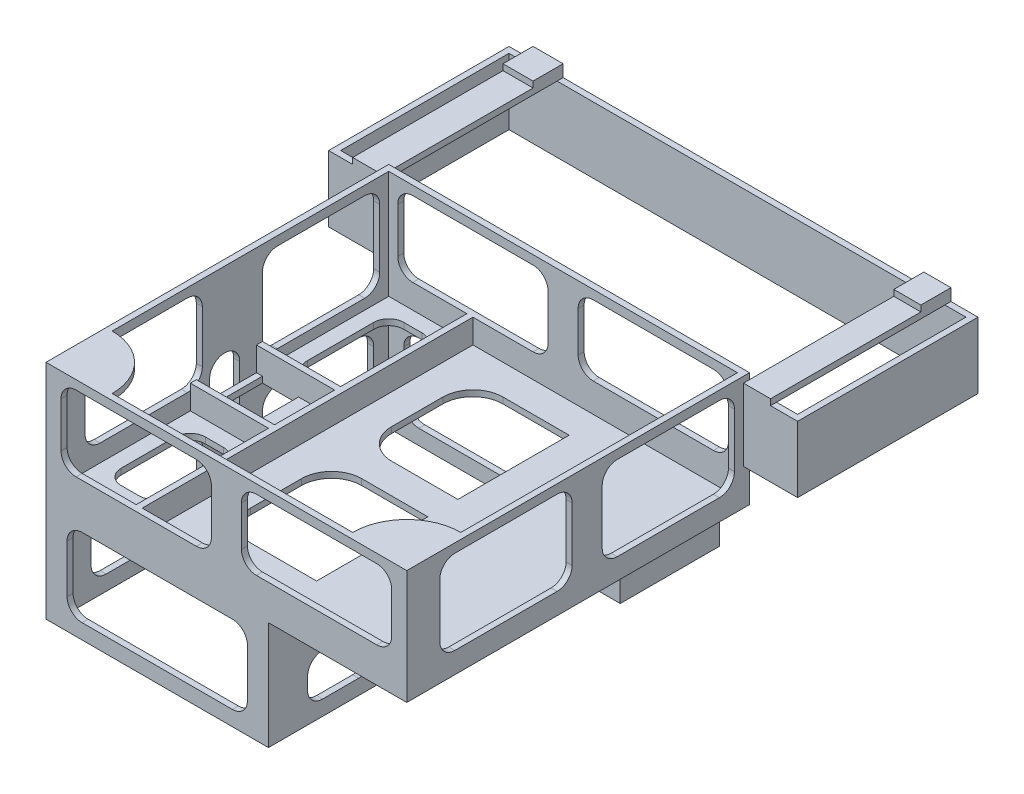
from build123d import *

# Parameters (mm, degrees)
SKETCH1_W                = 60
SKETCH1_H                = 54
BOSS_EXTRUDE1_DEPTH      = 38
SKETCH2_W                = 44
SKETCH2_H                = 52
CUT_EXTRUDE1_DEPTH       = 19
SKETCH3_W                = 35
SKETCH3_H                = 52
CUT_EXTRUDE2_DEPTH       = 18
SKETCH4_W                = 6
SKETCH4_H                = 10
CUT_EXTRUDE3_DEPTH       = 38
SKETCH5_W                = 14
SKETCH5_H                = 52
CUT_EXTRUDE5_DEPTH       = 15
SKETCH6_W                = 13
SKETCH6_H                = 52
CUT_EXTRUDE6_DEPTH       = 4
SKETCH8_W                = 14
SKETCH8_H                = 12.5
CUT_EXTRUDE7_DEPTH       = 6
SKETCH10_W               = 12.5
SKETCH10_H               = 5
CUT_EXTRUDE8_DEPTH       = 6
SKETCH11_W               = 4.5
SKETCH11_H               = 5
CUT_EXTRUDE9_DEPTH       = 18
SKETCH12_W               = 5
SKETCH12_H               = 17
CUT_EXTRUDE10_DEPTH      = 13
CUT_EXTRUDE11_DEPTH      = 1
SKETCH14_W               = 13
SKETCH14_H               = 1
BOSS_EXTRUDE2_DEPTH      = 4
SKETCH15_W               = 13
SKETCH15_H               = 1
BOSS_EXTRUDE3_DEPTH      = 4
CUT_EXTRUDE12_DEPTH      = 1
CUT_EXTRUDE13_DEPTH      = 1
CUT_EXTRUDE14_DEPTH      = 1
CUT_EXTRUDE15_DEPTH      = 60
CUT_EXTRUDE16_START      = -1
CUT_EXTRUDE16_DEPTH      = 1
CUT_EXTRUDE17_DEPTH      = 89
CUT_EXTRUDE17_DEPTH_BACK = 10
CUT_EXTRUDE18_DEPTH      = 10
SKETCH23_W               = 58
SKETCH23_H               = 52
BOSS_EXTRUDE4_DEPTH      = 1
SKETCH24_W               = 40
SKETCH24_H               = 10
SKETCH24_W_2             = 10
SKETCH24_H_2             = 34
CUT_EXTRUDE20_DEPTH      = 1
FILLET1_R                = 9
FILLET2_R                = 9
FILLET3_R                = 9
FILLET4_R                = 9
SKETCH27_W               = 10
SKETCH27_H               = 11
BOSS_EXTRUDE10_DEPTH     = 1
SKETCH31_W               = 1
SKETCH31_H               = 11
BOSS_EXTRUDE12_DEPTH     = 29
SKETCH33_W               = 1
SKETCH33_H               = 11
BOSS_EXTRUDE13_DEPTH     = 78
SKETCH34_W               = 5
SKETCH34_H               = 30
SKETCH34_W_2             = 4.5
BOSS_EXTRUDE14_DEPTH     = 1
SKETCH35_W               = 28
SKETCH35_H               = 11
BOSS_EXTRUDE15_DEPTH     = 1
SKETCH37_W               = 30
SKETCH37_H               = 11
CUT_EXTRUDE21_DEPTH      = 1
SKETCH38_W               = 28
SKETCH38_H               = 11
BOSS_EXTRUDE16_DEPTH     = 1
SKETCH39_W               = 30
SKETCH39_H               = 11
CUT_EXTRUDE22_DEPTH      = 1
SKETCH40_W               = 60
SKETCH40_H               = 37
BOSS_EXTRUDE17_DEPTH     = 3
SKETCH41_W               = 35
SKETCH41_H               = 18
CUT_EXTRUDE23_DEPTH      = 3
SKETCH42_W               = 44
SKETCH42_H               = 18
CUT_EXTRUDE24_DEPTH      = 3
SKETCH44_W               = 13
SKETCH44_H               = 18
CUT_EXTRUDE25_DEPTH      = 3
SKETCH45_W               = 3
SKETCH45_H               = 14
CUT_EXTRUDE26_DEPTH      = 3
SKETCH47_W               = 60
SKETCH47_H               = 10
CUT_EXTRUDE27_DEPTH      = 1
SKETCH48_W               = 60
SKETCH48_H               = 10
CUT_EXTRUDE28_DEPTH      = 1
SKETCH49_W               = 60
SKETCH49_H               = 10
BOSS_EXTRUDE18_DEPTH     = 1
SKETCH50_W               = 40
SKETCH50_H               = 9
CUT_EXTRUDE29_DEPTH      = 1
FILLET5_R                = 9
FILLET6_R                = 9
SKETCH51_W               = 5
SKETCH51_H               = 5
SKETCH51_W_2             = 4.5
BOSS_EXTRUDE19_DEPTH     = 1
SKETCH53_W               = 8
SKETCH53_H               = 9
CUT_EXTRUDE30_DEPTH      = 18
SKETCH54_W               = 2.5
SKETCH54_H               = 16.5
CUT_EXTRUDE31_DEPTH      = 18
SKETCH55_W               = 19.362337095
SKETCH55_H               = 47.149460103
BOSS_EXTRUDE20_DEPTH     = 1
SKETCH57_W               = 15
SKETCH57_H               = 9
CUT_EXTRUDE32_DEPTH      = 15
SKETCH58_W               = 6.289823119
SKETCH58_H               = 14.401479923
BOSS_EXTRUDE21_DEPTH     = 1
SKETCH59_W               = 15
SKETCH59_H               = 9
BOSS_EXTRUDE26_DEPTH     = 1
SKETCH60_W               = 4.5
SKETCH60_H               = 5
CUT_EXTRUDE33_DEPTH      = 1
SKETCH61_W               = 14
SKETCH61_H               = 12.5
CUT_EXTRUDE34_DEPTH      = 18
SKETCH62_W               = 12.5
SKETCH62_H               = 5
CUT_EXTRUDE35_DEPTH      = 18
SKETCH63_W               = 20.5
SKETCH63_H               = 16.5
CUT_EXTRUDE36_DEPTH      = 12
SKETCH64_W               = 13.575669256
SKETCH64_H               = 6.720460735
BOSS_EXTRUDE27_DEPTH     = 1
CUT_EXTRUDE37_START      = -1
CUT_EXTRUDE37_DEPTH      = 1
CUT_EXTRUDE38_DEPTH      = 1
CUT_EXTRUDE39_DEPTH      = 1


with BuildPart() as part:
    # Sketch1 → Boss-Extrude1 (new body)
    with BuildSketch(Plane(origin=(0, 0, 0), x_dir=(1, 0, 0), z_dir=(0, 1, 0))):
        with Locations((-83.874465942, -33.946435202)):
            Rectangle(SKETCH1_W, SKETCH1_H)
    extrude(amount=BOSS_EXTRUDE1_DEPTH)

    # Sketch2 → Cut-Extrude1 (cut)
    with BuildSketch(Plane(origin=(0, 38, 0), x_dir=(1, 0, 0), z_dir=(0, 1, 0))):
        with Locations((-76.874465942, -33.946435202)):
            Rectangle(SKETCH2_W, SKETCH2_H)
    extrude(amount=-CUT_EXTRUDE1_DEPTH, mode=Mode.SUBTRACT)

    # Sketch3 → Cut-Extrude2 (cut)
    with BuildSketch(Plane(origin=(0, 0, 0), x_dir=(-1, 0, 0), z_dir=(0, -1, 0))):
        with Locations((95.374465942, -33.946435202)):
            Rectangle(SKETCH3_W, SKETCH3_H)
    extrude(amount=-CUT_EXTRUDE2_DEPTH, mode=Mode.SUBTRACT)

    # Sketch4 → Cut-Extrude3 (cut)
    with BuildSketch(Plane(origin=(0, 18, 0), x_dir=(-1, 0, 0), z_dir=(0, -1, 0))):
        with Locations((108.874465942, -34.946435202)):
            Rectangle(SKETCH4_W, SKETCH4_H)
    extrude(amount=-CUT_EXTRUDE3_DEPTH, mode=Mode.SUBTRACT)

    # Sketch5 → Cut-Extrude5 (cut)
    with BuildSketch(Plane(origin=(0, 38, 0), x_dir=(1, 0, 0), z_dir=(0, 1, 0))):
        with Locations((-105.874465942, -33.946435202)):
            Rectangle(SKETCH5_W, SKETCH5_H)
    extrude(amount=-CUT_EXTRUDE5_DEPTH, mode=Mode.SUBTRACT)

    # Sketch6 → Cut-Extrude6 (cut)
    with BuildSketch(Plane(origin=(0, 23, 0), x_dir=(1, 0, 0), z_dir=(0, 1, 0))):
        with Locations((-106.374465942, -33.946435202)):
            Rectangle(SKETCH6_W, SKETCH6_H)
    extrude(amount=-CUT_EXTRUDE6_DEPTH, mode=Mode.SUBTRACT)

    # Sketch8 → Cut-Extrude7 (cut)
    with BuildSketch(Plane(origin=(0, 0, 0), x_dir=(-1, 0, 0), z_dir=(0, -1, 0))):
        with Locations((65.374465942, -17.696435202)):
            Rectangle(SKETCH8_W, SKETCH8_H)
    extrude(amount=-CUT_EXTRUDE7_DEPTH, mode=Mode.SUBTRACT)

    # Sketch10 → Cut-Extrude8 (cut)
    with BuildSketch(Plane(origin=(-72.374465942, 0, 0), x_dir=(0, 0, -1), z_dir=(1, 0, 0))):
        with Locations((-17.696435202, 3.5)):
            Rectangle(SKETCH10_W, SKETCH10_H)
    extrude(amount=-CUT_EXTRUDE8_DEPTH, mode=Mode.SUBTRACT)

    # Sketch11 → Cut-Extrude9 (cut)
    with BuildSketch(Plane.XZ):
        with Locations((-66.124465942, 48.446435202)):
            Rectangle(SKETCH11_W, SKETCH11_H)
    extrude(amount=-CUT_EXTRUDE9_DEPTH, mode=Mode.SUBTRACT)

    # Sketch12 → Cut-Extrude10 (cut)
    with BuildSketch(Plane(origin=(-68.374465942, 0, 0), x_dir=(0, 0, -1), z_dir=(1, 0, 0))):
        with Locations((-48.446435202, 9.5)):
            Rectangle(SKETCH12_W, SKETCH12_H)
    extrude(amount=-CUT_EXTRUDE10_DEPTH, mode=Mode.SUBTRACT)

    # Sketch13 → Cut-Extrude11 (cut)
    with BuildSketch(Plane.ZY.offset(113.874465942)):
        with BuildLine():
            Line((32.733045904, 15), (32.733045904, 22))
            ThreePointArc((32.733045904, 22), (35.233045904, 24.5), (37.733045904, 22))
            Line((37.733045904, 22), (37.733045904, 15))
            ThreePointArc((37.733045904, 15), (35.233045904, 12.5), (32.733045904, 15))
        make_face()
    extrude(amount=-CUT_EXTRUDE11_DEPTH, mode=Mode.SUBTRACT)

    # Sketch14 → Boss-Extrude2 (add)
    with BuildSketch(Plane(origin=(0, 19, 0), x_dir=(1, 0, 0), z_dir=(0, 1, 0))):
        with Locations((-106.374465942, -40.446435202)):
            Rectangle(SKETCH14_W, SKETCH14_H)
    extrude(amount=BOSS_EXTRUDE2_DEPTH)

    # Sketch15 → Boss-Extrude3 (add)
    with BuildSketch(Plane(origin=(0, 19, 0), x_dir=(1, 0, 0), z_dir=(0, 1, 0))):
        with Locations((-106.374465942, -29.446435202)):
            Rectangle(SKETCH15_W, SKETCH15_H)
    extrude(amount=BOSS_EXTRUDE3_DEPTH)

    # Sketch16 → Cut-Extrude12 (cut)
    with BuildSketch(Plane(origin=(0, 19, 0), x_dir=(1, 0, 0), z_dir=(0, 1, 0))):
        with BuildLine():
            Line((-64.874465942, -54.946435202), (-88.874465942, -54.946435202))
            ThreePointArc((-88.874465942, -54.946435202), (-92.409999848, -53.481969108), (-93.874465942, -49.946435202))
            Line((-93.874465942, -49.946435202), (-93.874465942, -41.446435202))
            ThreePointArc((-93.874465942, -41.446435202), (-92.409999848, -37.910901296), (-88.874465942, -36.446435202))
            Line((-88.874465942, -36.446435202), (-64.874465942, -36.446435202))
            ThreePointArc((-64.874465942, -36.446435202), (-61.338932037, -37.910901296), (-59.874465942, -41.446435202))
            Line((-59.874465942, -41.446435202), (-59.874465942, -49.946435202))
            ThreePointArc((-59.874465942, -49.946435202), (-61.338932037, -53.481969108), (-64.874465942, -54.946435202))
        make_face()
        with BuildLine():
            Line((-88.874465942, -31.446435202), (-64.874465942, -31.446435202))
            ThreePointArc((-64.874465942, -31.446435202), (-61.338932037, -29.981969108), (-59.874465942, -26.446435202))
            Line((-59.874465942, -26.446435202), (-59.874465942, -17.946435202))
            ThreePointArc((-59.874465942, -17.946435202), (-61.338932037, -14.410901296), (-64.874465942, -12.946435202))
            Line((-64.874465942, -12.946435202), (-88.874465942, -12.946435202))
            ThreePointArc((-88.874465942, -12.946435202), (-92.409999848, -14.410901296), (-93.874465942, -17.946435202))
            Line((-93.874465942, -17.946435202), (-93.874465942, -26.446435202))
            ThreePointArc((-93.874465942, -26.446435202), (-92.409999848, -29.981969108), (-88.874465942, -31.446435202))
        make_face()
    extrude(amount=-CUT_EXTRUDE12_DEPTH, mode=Mode.SUBTRACT)

    # Sketch17 → Cut-Extrude13 (cut)
    with BuildSketch(Plane(origin=(0, 19, 0), x_dir=(1, 0, 0), z_dir=(0, 1, 0))):
        with BuildLine():
            Line((-104.874465942, -57.446435202), (-107.874465942, -57.446435202))
            ThreePointArc((-107.874465942, -57.446435202), (-109.642232895, -56.714202155), (-110.374465942, -54.946435202))
            Line((-110.374465942, -54.946435202), (-110.374465942, -45.946435202))
            ThreePointArc((-110.374465942, -45.946435202), (-109.642232895, -44.178668249), (-107.874465942, -43.446435202))
            Line((-107.874465942, -43.446435202), (-104.874465942, -43.446435202))
            ThreePointArc((-104.874465942, -43.446435202), (-103.10669899, -44.178668249), (-102.374465942, -45.946435202))
            Line((-102.374465942, -45.946435202), (-102.374465942, -54.946435202))
            ThreePointArc((-102.374465942, -54.946435202), (-103.10669899, -56.714202155), (-104.874465942, -57.446435202))
        make_face()
        with BuildLine():
            Line((-104.874465942, -26.446435202), (-107.874465942, -26.446435202))
            ThreePointArc((-107.874465942, -26.446435202), (-109.642232895, -25.714202155), (-110.374465942, -23.946435202))
            Line((-110.374465942, -23.946435202), (-110.374465942, -12.946435202))
            ThreePointArc((-110.374465942, -12.946435202), (-109.642232895, -11.178668249), (-107.874465942, -10.446435202))
            Line((-107.874465942, -10.446435202), (-104.874465942, -10.446435202))
            ThreePointArc((-104.874465942, -10.446435202), (-103.10669899, -11.178668249), (-102.374465942, -12.946435202))
            Line((-102.374465942, -12.946435202), (-102.374465942, -23.946435202))
            ThreePointArc((-102.374465942, -23.946435202), (-103.10669899, -25.714202155), (-104.874465942, -26.446435202))
        make_face()
    extrude(amount=-CUT_EXTRUDE13_DEPTH, mode=Mode.SUBTRACT)

    # Sketch18 → Cut-Extrude14 (cut)
    with BuildSketch(Plane(origin=(-53.874465942, 0, 0), x_dir=(0, 0, -1), z_dir=(1, 0, 0))):
        with BuildLine():
            Line((-55.946435202, 35.5), (-38.946435202, 35.5))
            ThreePointArc((-38.946435202, 35.5), (-37.178668249, 34.767766953), (-36.446435202, 33))
            Line((-36.446435202, 33), (-36.446435202, 24))
            ThreePointArc((-36.446435202, 24), (-37.178668249, 22.232233047), (-38.946435202, 21.5))
            Line((-38.946435202, 21.5), (-55.946435202, 21.5))
            ThreePointArc((-55.946435202, 21.5), (-57.714202155, 22.232233047), (-58.446435202, 24))
            Line((-58.446435202, 24), (-58.446435202, 33))
            ThreePointArc((-58.446435202, 33), (-57.714202155, 34.767766953), (-55.946435202, 35.5))
        make_face()
        with BuildLine():
            Line((-28.946435202, 35.5), (-11.946435202, 35.5))
            ThreePointArc((-11.946435202, 35.5), (-10.178668249, 34.767766953), (-9.446435202, 33))
            Line((-9.446435202, 33), (-9.446435202, 24))
            ThreePointArc((-9.446435202, 24), (-10.178668249, 22.232233047), (-11.946435202, 21.5))
            Line((-11.946435202, 21.5), (-28.946435202, 21.5))
            ThreePointArc((-28.946435202, 21.5), (-30.714202155, 22.232233047), (-31.446435202, 24))
            Line((-31.446435202, 24), (-31.446435202, 33))
            ThreePointArc((-31.446435202, 33), (-30.714202155, 34.767766953), (-28.946435202, 35.5))
        make_face()
    extrude(amount=-CUT_EXTRUDE14_DEPTH, mode=Mode.SUBTRACT)

    # Sketch19 → Cut-Extrude15 (cut)
    with BuildSketch(Plane(origin=(0, 0, 6.946435202), x_dir=(-1, 0, 0), z_dir=(0, 0, -1))):
        with BuildLine():
            Line((58.874465942, 35.5), (78.874465942, 35.5))
            ThreePointArc((78.874465942, 35.5), (80.642232895, 34.767766953), (81.374465942, 33))
            Line((81.374465942, 33), (81.374465942, 26.304053451))
            ThreePointArc((81.374465942, 26.304053451), (80.642232895, 24.536286498), (78.874465942, 23.804053451))
            Line((78.874465942, 23.804053451), (58.874465942, 23.804053451))
            ThreePointArc((58.874465942, 23.804053451), (57.10669899, 24.536286498), (56.374465942, 26.304053451))
            Line((56.374465942, 26.304053451), (56.374465942, 33))
            ThreePointArc((56.374465942, 33), (57.10669899, 34.767766953), (58.874465942, 35.5))
        make_face()
        with BuildLine():
            Line((88.874465942, 35.5), (108.874465942, 35.5))
            ThreePointArc((108.874465942, 35.5), (110.642232895, 34.767766953), (111.374465942, 33))
            Line((111.374465942, 33), (111.374465942, 25.5))
            ThreePointArc((111.374465942, 25.5), (110.642232895, 23.732233047), (108.874465942, 23))
            Line((108.874465942, 23), (88.874465942, 23))
            ThreePointArc((88.874465942, 23), (87.10669899, 23.732233047), (86.374465942, 25.5))
            Line((86.374465942, 25.5), (86.374465942, 33))
            ThreePointArc((86.374465942, 33), (87.10669899, 34.767766953), (88.874465942, 35.5))
        make_face()
    extrude(amount=-CUT_EXTRUDE15_DEPTH, mode=Mode.SUBTRACT)

    # Sketch20 → Cut-Extrude16 (cut)
    with BuildSketch(Plane.ZY.offset(113.874465942).offset(CUT_EXTRUDE16_START)):
        with BuildLine():
            Line((11.946435202, 35.5), (26.446435202, 35.5))
            ThreePointArc((26.446435202, 35.5), (28.214202155, 34.767766953), (28.946435202, 33))
            Line((28.946435202, 33), (28.946435202, 23.221982389))
            ThreePointArc((28.946435202, 23.221982389), (28.214202155, 21.454215436), (26.446435202, 20.721982389))
            Line((26.446435202, 20.721982389), (11.946435202, 20.721982389))
            ThreePointArc((11.946435202, 20.721982389), (10.178668249, 21.454215436), (9.446435202, 23.221982389))
            Line((9.446435202, 23.221982389), (9.446435202, 33))
            ThreePointArc((9.446435202, 33), (10.178668249, 34.767766953), (11.946435202, 35.5))
        make_face()
        with BuildLine():
            Line((41.446435202, 35.5), (55.946435202, 35.5))
            ThreePointArc((55.946435202, 35.5), (57.714202155, 34.767766953), (58.446435202, 33))
            Line((58.446435202, 33), (58.446435202, 24.375603128))
            ThreePointArc((58.446435202, 24.375603128), (57.714202155, 22.607836175), (55.946435202, 21.875603128))
            Line((55.946435202, 21.875603128), (41.446435202, 21.875603128))
            ThreePointArc((41.446435202, 21.875603128), (39.678668249, 22.607836175), (38.946435202, 24.375603128))
            Line((38.946435202, 24.375603128), (38.946435202, 33))
            ThreePointArc((38.946435202, 33), (39.678668249, 34.767766953), (41.446435202, 35.5))
        make_face()
    extrude(amount=CUT_EXTRUDE16_DEPTH, mode=Mode.SUBTRACT)

    # Sketch21 → Cut-Extrude17 (cut, two sides: drawn at the far end of the back side and taken through both)
    with BuildSketch(Plane(origin=(0, 0, 59.946435202), x_dir=(-1, 0, 0), z_dir=(0, 0, -1)).offset(-CUT_EXTRUDE17_DEPTH_BACK)):
        with BuildLine():
            Line((107.874465942, 2.5), (82.874465942, 2.5))
            ThreePointArc((82.874465942, 2.5), (81.10669899, 3.232233047), (80.374465942, 5))
            Line((80.374465942, 5), (80.374465942, 13))
            ThreePointArc((80.374465942, 13), (81.10669899, 14.767766953), (82.874465942, 15.5))
            Line((82.874465942, 15.5), (107.874465942, 15.5))
            ThreePointArc((107.874465942, 15.5), (109.642232895, 14.767766953), (110.374465942, 13))
            Line((110.374465942, 13), (110.374465942, 5))
            ThreePointArc((110.374465942, 5), (109.642232895, 3.232233047), (107.874465942, 2.5))
        make_face()
    extrude(amount=CUT_EXTRUDE17_DEPTH + CUT_EXTRUDE17_DEPTH_BACK, mode=Mode.SUBTRACT)

    # Sketch22 → Cut-Extrude18 (cut)
    with BuildSketch(Plane(origin=(-112.874465942, 0, 0), x_dir=(0, 0, -1), z_dir=(1, 0, 0))):
        with BuildLine():
            Line((-12.946435202, 2.5), (-26.446435202, 2.5))
            ThreePointArc((-26.446435202, 2.5), (-28.214202155, 3.232233047), (-28.946435202, 5))
            Line((-28.946435202, 5), (-28.946435202, 13))
            ThreePointArc((-28.946435202, 13), (-28.214202155, 14.767766953), (-26.446435202, 15.5))
            Line((-26.446435202, 15.5), (-12.946435202, 15.5))
            ThreePointArc((-12.946435202, 15.5), (-11.178668249, 14.767766953), (-10.446435202, 13))
            Line((-10.446435202, 13), (-10.446435202, 5))
            ThreePointArc((-10.446435202, 5), (-11.178668249, 3.232233047), (-12.946435202, 2.5))
        make_face()
        with BuildLine():
            Line((-41.446435202, 2.5), (-54.946435202, 2.5))
            ThreePointArc((-54.946435202, 2.5), (-56.714202155, 3.232233047), (-57.446435202, 5))
            Line((-57.446435202, 5), (-57.446435202, 13))
            ThreePointArc((-57.446435202, 13), (-56.714202155, 14.767766953), (-54.946435202, 15.5))
            Line((-54.946435202, 15.5), (-41.446435202, 15.5))
            ThreePointArc((-41.446435202, 15.5), (-39.678668249, 14.767766953), (-38.946435202, 13))
            Line((-38.946435202, 13), (-38.946435202, 5))
            ThreePointArc((-38.946435202, 5), (-39.678668249, 3.232233047), (-41.446435202, 2.5))
        make_face()
    extrude(amount=-CUT_EXTRUDE18_DEPTH, mode=Mode.SUBTRACT)

    # Sketch23 → Boss-Extrude4 (add)
    with BuildSketch(Plane(origin=(0, 38, 0), x_dir=(1, 0, 0), z_dir=(0, 1, 0))):
        with Locations((-83.874465942, -33.946435202)):
            Rectangle(SKETCH23_W, SKETCH23_H)
    extrude(amount=-BOSS_EXTRUDE4_DEPTH)

    # Sketch24 → Cut-Extrude20 (cut)
    with BuildSketch(Plane(origin=(0, 38, 0), x_dir=(1, 0, 0), z_dir=(0, 1, 0))):
        with Locations((-83.874465942, -55.946435202)):
            Rectangle(SKETCH24_W, SKETCH24_H)
        with Locations((-58.874465942, -33.946435202)):
            Rectangle(SKETCH24_W_2, SKETCH24_H_2)
        with Locations((-83.874465942, -11.946435202)):
            Rectangle(SKETCH24_W, SKETCH24_H)
        with Locations((-83.874465942, -33.946435202)):
            Rectangle(SKETCH24_W, SKETCH24_H_2)
        with Locations((-108.874465942, -33.946435202)):
            Rectangle(SKETCH24_W_2, SKETCH24_H_2)
    extrude(amount=-CUT_EXTRUDE20_DEPTH, mode=Mode.SUBTRACT)

    # Fillet1
    fillet1_edges = [part.edges().sort_by_distance(p)[0] for p in [
        (-103.874465942, 37.5, 50.946435202),
    ]]
    fillet(fillet1_edges, radius=FILLET1_R)

    # Fillet2
    fillet2_edges = [part.edges().sort_by_distance(p)[0] for p in [
        (-63.874465942, 37.5, 16.946435202),
    ]]
    fillet(fillet2_edges, radius=FILLET2_R)

    # Fillet3
    fillet3_edges = [part.edges().sort_by_distance(p)[0] for p in [
        (-63.874465942, 37.5, 50.946435202),
    ]]
    fillet(fillet3_edges, radius=FILLET3_R)

    # Fillet4
    fillet4_edges = [part.edges().sort_by_distance(p)[0] for p in [
        (-103.874465942, 37.5, 16.946435202),
    ]]
    fillet(fillet4_edges, radius=FILLET4_R)

    # Sketch27 → Boss-Extrude10 (add)
    with BuildSketch(Plane(origin=(0, 0, 6.946435202), x_dir=(-1, 0, 0), z_dir=(0, 0, -1))):
        with Locations((48.874465942, 29.5)):
            Rectangle(SKETCH27_W, SKETCH27_H)
        with Locations((118.874465942, 29.5)):
            Rectangle(SKETCH27_W, SKETCH27_H)
    extrude(amount=-BOSS_EXTRUDE10_DEPTH)

    # Sketch31 → Boss-Extrude12 (add)
    with BuildSketch(Plane(origin=(0, 0, 6.946435202), x_dir=(-1, 0, 0), z_dir=(0, 0, -1))):
        with Locations((44.374465942, 29.5)):
            Rectangle(SKETCH31_W, SKETCH31_H)
        with Locations((123.374465942, 29.5)):
            Rectangle(SKETCH31_W, SKETCH31_H)
    extrude(amount=BOSS_EXTRUDE12_DEPTH)

    # Sketch33 → Boss-Extrude13 (add)
    with BuildSketch(Plane.ZY.offset(44.874465942)):
        with Locations((-21.553564798, 29.5)):
            Rectangle(SKETCH33_W, SKETCH33_H)
    extrude(amount=BOSS_EXTRUDE13_DEPTH)

    # Sketch34 → Boss-Extrude14 (add)
    with BuildSketch(Plane(origin=(0, 35, 0), x_dir=(1, 0, 0), z_dir=(0, 1, 0))):
        with Locations((-116.374465942, 7.053564798)):
            Rectangle(SKETCH34_W, SKETCH34_H)
        with Locations((-51.624465942, 7.053564798)):
            Rectangle(SKETCH34_W_2, SKETCH34_H)
    extrude(amount=BOSS_EXTRUDE14_DEPTH)

    # Sketch35 → Boss-Extrude15 (add)
    with BuildSketch(Plane(origin=(-122.874465942, 0, 0), x_dir=(0, 0, -1), z_dir=(1, 0, 0))):
        with Locations((7.053564798, 29.5)):
            Rectangle(SKETCH35_W, SKETCH35_H)
    extrude(amount=BOSS_EXTRUDE15_DEPTH)

    # Sketch37 → Cut-Extrude21 (cut)
    with BuildSketch(Plane.ZY.offset(123.874465942)):
        with Locations((-7.053564798, 29.5)):
            Rectangle(SKETCH37_W, SKETCH37_H)
    extrude(amount=-CUT_EXTRUDE21_DEPTH, mode=Mode.SUBTRACT)

    # Sketch38 → Boss-Extrude16 (add)
    with BuildSketch(Plane.ZY.offset(44.874465942)):
        with Locations((-7.053564798, 29.5)):
            Rectangle(SKETCH38_W, SKETCH38_H)
    extrude(amount=BOSS_EXTRUDE16_DEPTH)

    # Sketch39 → Cut-Extrude22 (cut)
    with BuildSketch(Plane(origin=(-43.874465942, 0, 0), x_dir=(0, 0, -1), z_dir=(1, 0, 0))):
        with Locations((7.053564798, 29.5)):
            Rectangle(SKETCH39_W, SKETCH39_H)
    extrude(amount=-CUT_EXTRUDE22_DEPTH, mode=Mode.SUBTRACT)

    # Sketch40 → Boss-Extrude17 (add)
    with BuildSketch(Plane.XY.offset(60.946435202)):
        with Locations((-83.874465942, 18.5)):
            Rectangle(SKETCH40_W, SKETCH40_H)
    extrude(amount=BOSS_EXTRUDE17_DEPTH)

    # Sketch41 → Cut-Extrude23 (cut)
    with BuildSketch(Plane(origin=(0, 0, 59.946435202), x_dir=(-1, 0, 0), z_dir=(0, 0, -1))):
        with Locations((95.374465942, 9)):
            Rectangle(SKETCH41_W, SKETCH41_H)
    extrude(amount=-CUT_EXTRUDE23_DEPTH, mode=Mode.SUBTRACT)

    # Sketch42 → Cut-Extrude24 (cut)
    with BuildSketch(Plane(origin=(0, 0, 59.946435202), x_dir=(-1, 0, 0), z_dir=(0, 0, -1))):
        with Locations((76.874465942, 28)):
            Rectangle(SKETCH42_W, SKETCH42_H)
    extrude(amount=-CUT_EXTRUDE24_DEPTH, mode=Mode.SUBTRACT)

    # Sketch44 → Cut-Extrude25 (cut)
    with BuildSketch(Plane(origin=(0, 0, 59.946435202), x_dir=(-1, 0, 0), z_dir=(0, 0, -1))):
        with Locations((106.374465942, 28)):
            Rectangle(SKETCH44_W, SKETCH44_H)
    extrude(amount=-CUT_EXTRUDE25_DEPTH, mode=Mode.SUBTRACT)

    # Sketch45 → Cut-Extrude26 (cut)
    with BuildSketch(Plane(origin=(-98.874465942, 0, 0), x_dir=(0, 0, -1), z_dir=(1, 0, 0))):
        with Locations((-61.446435202, 30)):
            Rectangle(SKETCH45_W, SKETCH45_H)
    extrude(amount=-CUT_EXTRUDE26_DEPTH, mode=Mode.SUBTRACT)

    # Sketch47 → Cut-Extrude27 (cut)
    with BuildSketch(Plane(origin=(0, 38, 0), x_dir=(1, 0, 0), z_dir=(0, 1, 0))):
        with Locations((-83.874465942, -11.946435202)):
            Rectangle(SKETCH47_W, SKETCH47_H)
    extrude(amount=-CUT_EXTRUDE27_DEPTH, mode=Mode.SUBTRACT)

    # Sketch48 → Cut-Extrude28 (cut)
    with BuildSketch(Plane(origin=(0, 38, 0), x_dir=(1, 0, 0), z_dir=(0, 1, 0))):
        with Locations((-83.874465942, -55.946435202)):
            Rectangle(SKETCH48_W, SKETCH48_H)
    extrude(amount=-CUT_EXTRUDE28_DEPTH, mode=Mode.SUBTRACT)

    # Sketch49 → Boss-Extrude18 (add)
    with BuildSketch(Plane(origin=(0, 37, 0), x_dir=(1, 0, 0), z_dir=(0, 1, 0))):
        with Locations((-83.874465942, -58.946435202)):
            Rectangle(SKETCH49_W, SKETCH49_H)
    extrude(amount=-BOSS_EXTRUDE18_DEPTH)

    # Sketch50 → Cut-Extrude29 (cut)
    with BuildSketch(Plane(origin=(0, 37, 0), x_dir=(1, 0, 0), z_dir=(0, 1, 0))):
        with Locations((-83.874465942, -58.446435202)):
            Rectangle(SKETCH50_W, SKETCH50_H)
    extrude(amount=-CUT_EXTRUDE29_DEPTH, mode=Mode.SUBTRACT)

    # Fillet5
    fillet5_edges = [part.edges().sort_by_distance(p)[0] for p in [
        (-103.874465942, 36.5, 53.946435202),
    ]]
    fillet(fillet5_edges, radius=FILLET5_R - 0.0001)  # a hair under: the kernel refuses the full size

    # Fillet6
    fillet6_edges = [part.edges().sort_by_distance(p)[0] for p in [
        (-63.874465942, 36.5, 53.946435202),
    ]]
    fillet(fillet6_edges, radius=FILLET6_R - 0.0001)  # a hair under: the kernel refuses the full size

    # Sketch51 → Boss-Extrude19 (add)
    with BuildSketch(Plane(origin=(0, 36, 0), x_dir=(1, 0, 0), z_dir=(0, 1, 0))):
        with Locations((-116.374465942, 19.553564798)):
            Rectangle(SKETCH51_W, SKETCH51_H)
        with Locations((-51.624465942, 19.553564798)):
            Rectangle(SKETCH51_W_2, SKETCH51_H)
    extrude(amount=BOSS_EXTRUDE19_DEPTH)

    # Sketch53 → Cut-Extrude30 (cut)
    with BuildSketch(Plane(origin=(0, 0, 0), x_dir=(-1, 0, 0), z_dir=(0, -1, 0))):
        Polygon((76.874465942, -34.339205591), (53.874465942, -34.339205591), (53.874465942, -43.946435202), (61.874465942, -43.946435202), (76.874465942, -43.946435202), align=None)
        with Locations((57.874465942, -48.446435202)):
            Rectangle(SKETCH53_W, SKETCH53_H)
        Polygon((61.874465942, -52.946435202), (53.874465942, -52.946435202), (53.874465942, -63.946435202), (76.874465942, -63.946435202), (76.874465942, -52.946435202), align=None)
    extrude(amount=-CUT_EXTRUDE30_DEPTH, mode=Mode.SUBTRACT)

    # Sketch54 → Cut-Extrude31 (cut)
    with BuildSketch(Plane(origin=(0, 0, 0), x_dir=(-1, 0, 0), z_dir=(0, -1, 0))):
        Polygon((53.874465942, -25.946435202), (53.874465942, -34.339205591), (76.874465942, -34.339205591), (76.874465942, -25.946435202), (56.374465942, -25.946435202), align=None)
        with Locations((55.124465942, -17.696435202)):
            Rectangle(SKETCH54_W, SKETCH54_H)
        Polygon((53.874465942, -6.946435202), (53.874465942, -9.446435202), (56.374465942, -9.446435202), (76.874465942, -9.446435202), (76.874465942, -6.946435202), align=None)
    extrude(amount=-CUT_EXTRUDE31_DEPTH, mode=Mode.SUBTRACT)

    # Sketch55 → Boss-Extrude20 (add)
    with BuildSketch(Plane(origin=(0, 19, 0), x_dir=(1, 0, 0), z_dir=(0, 1, 0))):
        with Locations((-68.193297395, -34.218039862)):
            Rectangle(SKETCH55_W, SKETCH55_H)
    extrude(amount=-BOSS_EXTRUDE20_DEPTH)

    # Sketch57 → Cut-Extrude32 (cut)
    with BuildSketch(Plane(origin=(0, 0, 0), x_dir=(-1, 0, 0), z_dir=(0, -1, 0))):
        with Locations((69.374465942, -48.446435202)):
            Rectangle(SKETCH57_W, SKETCH57_H)
    extrude(amount=-CUT_EXTRUDE32_DEPTH, mode=Mode.SUBTRACT)

    # Sketch58 → Boss-Extrude21 (add)
    with BuildSketch(Plane(origin=(-76.874465942, 0, 0), x_dir=(0, 0, -1), z_dir=(1, 0, 0))):
        with Locations((-48.091346762, 7.799260039)):
            Rectangle(SKETCH58_W, SKETCH58_H)
    extrude(amount=-BOSS_EXTRUDE21_DEPTH)

    # Sketch59 → Boss-Extrude26 (add)
    with BuildSketch(Plane(origin=(0, 15, 0), x_dir=(-1, 0, 0), z_dir=(0, -1, 0))):
        with Locations((69.374465942, -48.446435202)):
            Rectangle(SKETCH59_W, SKETCH59_H)
    extrude(amount=BOSS_EXTRUDE26_DEPTH)

    # Sketch60 → Cut-Extrude33 (cut)
    with BuildSketch(Plane(origin=(0, 14, 0), x_dir=(-1, 0, 0), z_dir=(0, -1, 0))):
        with Locations((66.124465942, -48.446435202)):
            Rectangle(SKETCH60_W, SKETCH60_H)
    extrude(amount=-CUT_EXTRUDE33_DEPTH, mode=Mode.SUBTRACT)

    # Sketch61 → Cut-Extrude34 (cut)
    with BuildSketch(Plane(origin=(0, 0, 0), x_dir=(-1, 0, 0), z_dir=(0, -1, 0))):
        with Locations((65.374465942, -17.696435202)):
            Rectangle(SKETCH61_W, SKETCH61_H)
    extrude(amount=-CUT_EXTRUDE34_DEPTH, mode=Mode.SUBTRACT)

    # Sketch62 → Cut-Extrude35 (cut)
    with BuildSketch(Plane.ZY.offset(77.874465942)):
        with Locations((17.696435202, 15.5)):
            Rectangle(SKETCH62_W, SKETCH62_H)
    extrude(amount=-CUT_EXTRUDE35_DEPTH, mode=Mode.SUBTRACT)

    # Sketch63 → Cut-Extrude36 (cut)
    with BuildSketch(Plane.XZ):
        with Locations((-66.624465942, 17.696435202)):
            Rectangle(SKETCH63_W, SKETCH63_H)
    extrude(amount=-CUT_EXTRUDE36_DEPTH, mode=Mode.SUBTRACT)

    # Sketch64 → Boss-Extrude27 (add)
    with BuildSketch(Plane(origin=(-76.874465942, 0, 0), x_dir=(0, 0, -1), z_dir=(1, 0, 0))):
        with Locations((-17.519703537, 4.074104241)):
            Rectangle(SKETCH64_W, SKETCH64_H)
    extrude(amount=-BOSS_EXTRUDE27_DEPTH)

    # Sketch65 → Cut-Extrude37 (cut)
    with BuildSketch(Plane.XY.offset(63.946435202).offset(CUT_EXTRUDE37_START)):
        with BuildLine():
            Line((-108.874465942, 35.5), (-88.874465942, 35.5))
            ThreePointArc((-88.874465942, 35.5), (-87.10669899, 34.767766953), (-86.374465942, 33))
            Line((-86.374465942, 33), (-86.374465942, 25.5))
            ThreePointArc((-86.374465942, 25.5), (-87.10669899, 23.732233047), (-88.874465942, 23))
            Line((-88.874465942, 23), (-108.874465942, 23))
            ThreePointArc((-108.874465942, 23), (-110.642232895, 23.732233047), (-111.374465942, 25.5))
            Line((-111.374465942, 25.5), (-111.374465942, 33))
            ThreePointArc((-111.374465942, 33), (-110.642232895, 34.767766953), (-108.874465942, 35.5))
        make_face()
        with BuildLine():
            Line((-78.874465942, 35.5), (-58.874465942, 35.5))
            ThreePointArc((-58.874465942, 35.5), (-57.10669899, 34.767766953), (-56.374465942, 33))
            Line((-56.374465942, 33), (-56.374465942, 26.304053451))
            ThreePointArc((-56.374465942, 26.304053451), (-57.10669899, 24.536286498), (-58.874465942, 23.804053451))
            Line((-58.874465942, 23.804053451), (-78.874465942, 23.804053451))
            ThreePointArc((-78.874465942, 23.804053451), (-80.642232895, 24.536286498), (-81.374465942, 26.304053451))
            Line((-81.374465942, 26.304053451), (-81.374465942, 33))
            ThreePointArc((-81.374465942, 33), (-80.642232895, 34.767766953), (-78.874465942, 35.5))
        make_face()
    extrude(amount=CUT_EXTRUDE37_DEPTH, mode=Mode.SUBTRACT)

    # Sketch66 → Cut-Extrude38 (cut)
    with BuildSketch(Plane.XY.offset(63.946435202)):
        with BuildLine():
            Line((-107.874465942, 15.5), (-82.874465942, 15.5))
            ThreePointArc((-82.874465942, 15.5), (-81.10669899, 14.767766953), (-80.374465942, 13))
            Line((-80.374465942, 13), (-80.374465942, 5))
            ThreePointArc((-80.374465942, 5), (-81.10669899, 3.232233047), (-82.874465942, 2.5))
            Line((-82.874465942, 2.5), (-107.874465942, 2.5))
            ThreePointArc((-107.874465942, 2.5), (-109.642232895, 3.232233047), (-110.374465942, 5))
            Line((-110.374465942, 5), (-110.374465942, 13))
            ThreePointArc((-110.374465942, 13), (-109.642232895, 14.767766953), (-107.874465942, 15.5))
        make_face()
    extrude(amount=-CUT_EXTRUDE38_DEPTH, mode=Mode.SUBTRACT)

    # Sketch67 → Cut-Extrude39 (cut)
    with BuildSketch(Plane(origin=(-76.874465942, 0, 0), x_dir=(0, 0, -1), z_dir=(1, 0, 0))):
        with BuildLine():
            Line((-38.946435202, 2.5), (-28.946435202, 2.5))
            ThreePointArc((-28.946435202, 2.5), (-27.178668249, 3.232233047), (-26.446435202, 5))
            Line((-26.446435202, 5), (-26.446435202, 13))
            ThreePointArc((-26.446435202, 13), (-27.178668249, 14.767766953), (-28.946435202, 15.5))
            Line((-28.946435202, 15.5), (-38.946435202, 15.5))
            ThreePointArc((-38.946435202, 15.5), (-40.714202155, 14.767766953), (-41.446435202, 13))
            Line((-41.446435202, 13), (-41.446435202, 5))
            ThreePointArc((-41.446435202, 5), (-40.714202155, 3.232233047), (-38.946435202, 2.5))
        make_face()
        with BuildLine():
            Line((-18.946435202, 2.5), (-12.946435202, 2.5))
            ThreePointArc((-12.946435202, 2.5), (-11.178668249, 3.232233047), (-10.446435202, 5))
            Line((-10.446435202, 5), (-10.446435202, 7))
            ThreePointArc((-10.446435202, 7), (-11.178668249, 8.767766953), (-12.946435202, 9.5))
            Line((-12.946435202, 9.5), (-18.946435202, 9.5))
            ThreePointArc((-18.946435202, 9.5), (-20.714202155, 8.767766953), (-21.446435202, 7))
            Line((-21.446435202, 7), (-21.446435202, 5))
            ThreePointArc((-21.446435202, 5), (-20.714202155, 3.232233047), (-18.946435202, 2.5))
        make_face()
        with BuildLine():
            Line((-54.946435202, 2.5), (-48.946435202, 2.5))
            ThreePointArc((-48.946435202, 2.5), (-47.178668249, 3.232233047), (-46.446435202, 5))
            Line((-46.446435202, 5), (-46.446435202, 7))
            ThreePointArc((-46.446435202, 7), (-47.178668249, 8.767766953), (-48.946435202, 9.5))
            Line((-48.946435202, 9.5), (-54.946435202, 9.5))
            ThreePointArc((-54.946435202, 9.5), (-56.714202155, 8.767766953), (-57.446435202, 7))
            Line((-57.446435202, 7), (-57.446435202, 5))
            ThreePointArc((-57.446435202, 5), (-56.714202155, 3.232233047), (-54.946435202, 2.5))
        make_face()
    extrude(amount=-CUT_EXTRUDE39_DEPTH, mode=Mode.SUBTRACT)


solid = part.part
